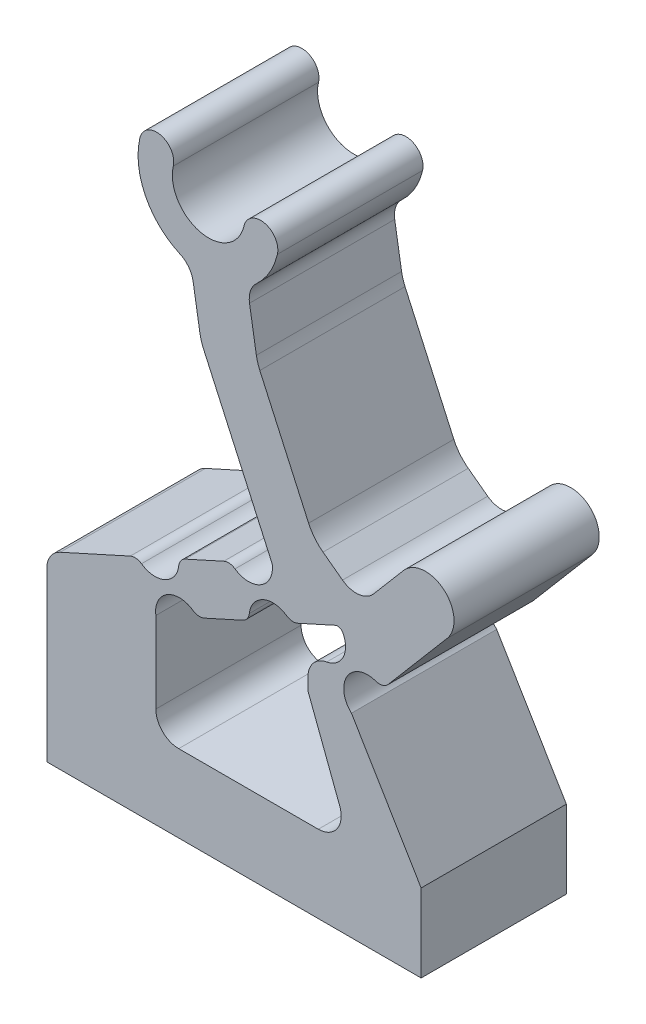
from build123d import *

# Parameters (mm, degrees)
BOSS_CONFIGUP_DEPTH = 6.35
FILLET1_R           = 1
FILLET2_R           = 1
FILLET3_R           = 0.5
FILLET4_R           = 0.25
FILLET5_R           = 2
FILLET7_R           = 1


with BuildPart() as part:
    # Sketch-ConfigUp → Boss-ConfigUp (new body)
    with BuildSketch(Plane.XY):
        with BuildLine():
            Line((8.036884771, -1.932633536), (5.768256233, -2.958998264))
            ThreePointArc((5.768256233, -2.958998264), (5.166306437, -4.054514783), (3.946064636, -3.783387604))
            Line((3.946064636, -3.783387604), (0, -5.568651912))
            Line((0, -5.568651912), (0, -13.535586773))
            Line((0, -13.535586773), (13.32406834, -13.535586773))
            Line((13.32406834, -13.535586773), (16.372100646, -13.535586773))
            Line((16.372100646, -13.535586773), (16.372100646, -10.126726416))
            Line((16.372100646, -10.126726416), (13.32406834, -5.02866566))
            ThreePointArc((13.32406834, -5.02866566), (13.235492103, -3.587430718), (14.672142717, -3.442382733))
            Line((14.672142717, -3.442382733), (17.513873441, -0.098510164))
            ThreePointArc((17.513873441, -0.098510164), (17.370838202, 1.663460585), (15.608867453, 1.520425346))
            Line((15.608867453, 1.520425346), (13.685572067, -0.742721767))
            Line((13.685572067, -0.742721767), (11.665230115, 0.757902988))
            Line((11.665230115, 0.757902988), (9.20945182, 6.186040346))
            Line((9.20945182, 6.186040346), (8.77136122, 8.849335746))
            ThreePointArc((8.77136122, 8.849335746), (9.609835457, 9.662661067), (10.086138806, 10.729278263))
            ThreePointArc((10.086138806, 10.729278263), (9.52657217, 11.630324976), (8.625525457, 11.07075834))
            ThreePointArc((8.625525457, 11.07075834), (6.718309914, 9.886342294), (5.533893867, 11.793557837))
            ThreePointArc((5.533893867, 11.793557837), (4.974327231, 12.69460455), (4.073280517, 12.135037914))
            ThreePointArc((4.073280517, 12.135037914), (4.437375542, 9.835058641), (6.304511976, 8.443558952))
            Line((6.304511976, 8.443558952), (6.742602576, 5.780263553))
            Line((6.742602576, 5.780263553), (9.859076368, -1.108244196))
            ThreePointArc((9.859076368, -1.108244196), (9.257126572, -2.203760715), (8.036884771, -1.932633536))
        make_face()
        with BuildLine():
            Line((8.861274111, -3.754825133), (6.592645572, -4.781189861))
            ThreePointArc((6.592645572, -4.781189861), (5.372403771, -4.510062682), (4.770453975, -5.605579201))
            Line((4.770453975, -5.605579201), (4.770453975, -10.149803039))
            Line((4.770453975, -10.149803039), (6.154904632, -10.149803039))
            Line((6.154904632, -10.149803039), (11.419062352, -10.149803039))
            Line((11.419062352, -10.149803039), (13.32406834, -10.149803039))
            Line((13.32406834, -10.149803039), (11.419062352, -5.128381701))
            Line((11.419062352, -5.128381701), (11.419062352, -3.40973015))
            ThreePointArc((11.419062352, -3.40973015), (12.78717247, -3.341145376), (12.803247984, -1.971411553))
            Line((12.803247984, -1.971411553), (10.683465708, -2.930435793))
            ThreePointArc((10.683465708, -2.930435793), (9.463223907, -2.659308614), (8.861274111, -3.754825133))
        make_face(mode=Mode.SUBTRACT)
    extrude(amount=BOSS_CONFIGUP_DEPTH)

    # Fillet1
    fillet1_edges = [part.edges().sort_by_distance(p)[0] for p in [
        (8.77136122, 8.849335746, 3.175),
        (6.304511976, 8.443558952, 3.175),
        (0, -5.568651912, 3.175),
        (13.685572067, -0.742721767, 3.175),
    ]]
    fillet(fillet1_edges, radius=FILLET1_R)

    # Fillet2
    fillet2_edges = [part.edges().sort_by_distance(p)[0] for p in [
        (11.419062352, -3.40973015, 3.175),
    ]]
    fillet(fillet2_edges, radius=FILLET2_R)

    # Fillet3
    fillet3_edges = [part.edges().sort_by_distance(p)[0] for p in [
        (14.672142717, -3.442382733, 3.175),
        (3.946064636, -3.783387604, 3.175),
        (6.592645572, -4.781189861, 3.175),
        (8.861274111, -3.754825133, 3.175),
        (8.036884771, -1.932633536, 3.175),
        (5.768256233, -2.958998264, 3.175),
        (10.683465708, -2.930435793, 3.175),
    ]]
    fillet(fillet3_edges, radius=FILLET3_R)

    # Fillet4
    fillet4_edges = [part.edges().sort_by_distance(p)[0] for p in [
        (9.859076368, -1.108244196, 3.175),
        (12.803247984, -1.971411553, 3.175),
    ]]
    fillet(fillet4_edges, radius=FILLET4_R)

    # Fillet5
    fillet5_edges = [part.edges().sort_by_distance(p)[0] for p in [
        (11.665230115, 0.757902988, 3.175),
        (9.20945182, 6.186040346, 3.175),
        (6.742602576, 5.780263553, 3.175),
    ]]
    fillet(fillet5_edges, radius=FILLET5_R)

    # Fillet7
    fillet7_edges = [part.edges().sort_by_distance(p)[0] for p in [
        (13.32406834, -10.149803039, 3.175),
        (4.770453975, -10.149803039, 3.175),
    ]]
    fillet(fillet7_edges, radius=FILLET7_R)


solid = part.part
